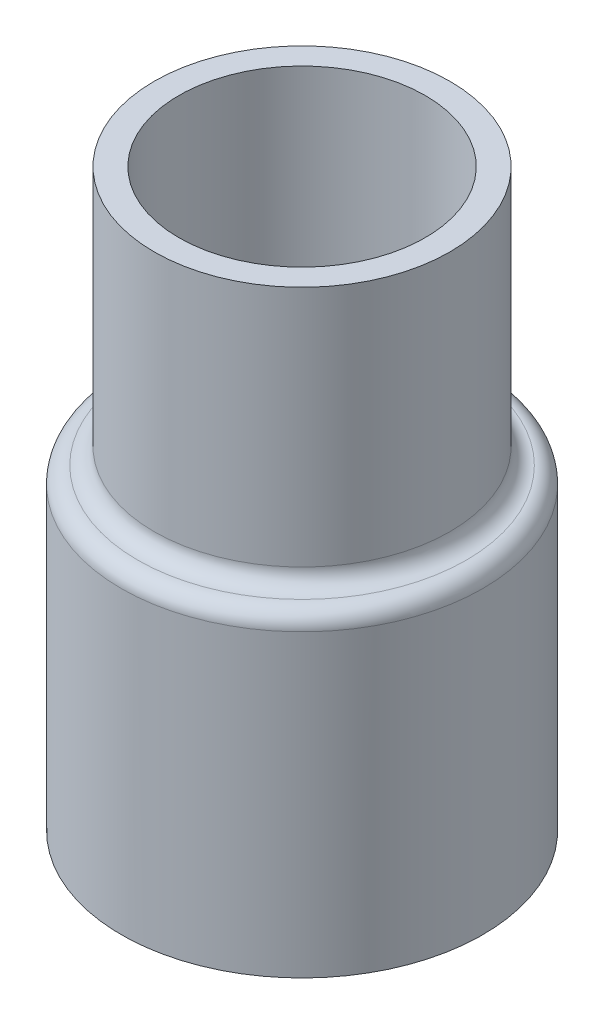
from build123d import *

# Parameters (mm, degrees)
FILLET1_R = 1


with BuildPart() as part:
    # Sketch1 → Revolve1 (revolve)
    with BuildSketch(Plane(origin=(0, 0, 0), x_dir=(0, 0, -1), z_dir=(1, 0, 0))):
        Polygon((7.5, 17.5), (9, 17.5), (9, 1.75), (11, 1.75), (11, -17.5), (9.5, -17.5), (9.5, -1.75), (7.5, -1.75), align=None)
    revolve(axis=Axis((0, -17.5, 0), (0, 1, 0)))

    # Fillet1
    fillet1_edges = [part.edges().sort_by_distance(p)[0] for p in [
        (0, 1.75, 11),
        (0, 1.75, 9),
    ]]
    fillet(fillet1_edges, radius=FILLET1_R - 0.0001)  # a hair under: the kernel refuses the full size


solid = part.part
